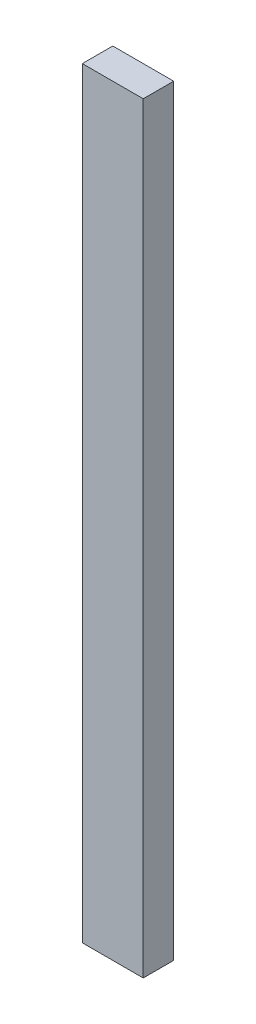
from build123d import *

# Parameters (mm, degrees)
SKETCH1_W           = 40
SKETCH1_H           = 500
BOSS_EXTRUDE1_DEPTH = 20


with BuildPart() as part:
    # Sketch1 → Boss-Extrude1 (new body)
    with BuildSketch(Plane.XY):
        Rectangle(SKETCH1_W, SKETCH1_H)
    extrude(amount=BOSS_EXTRUDE1_DEPTH)


solid = part.part
